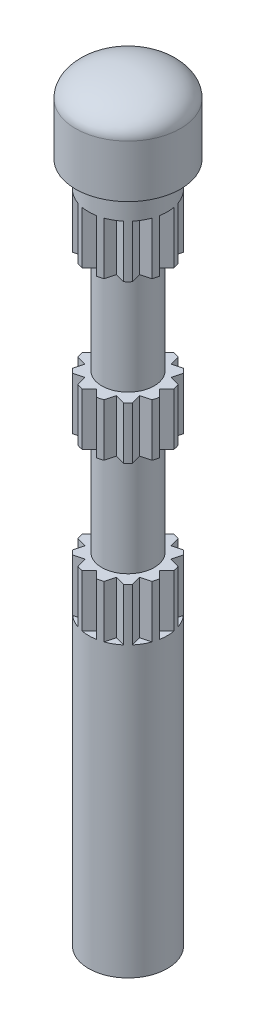
from build123d import *

# Parameters (mm, degrees)
SKETCH_2_R                = 1.288183927
SKETCH_2_R_2              = 0.75
CUT_EXTRUDE_1_DEPTH       = 13
SKETCH_3_R                = 0.4
CUT_EXTRUDE_2_DEPTH       = 5
SKETCH_8_W                = 0.443463538
SKETCH_8_H                = 2
CUT_EXTRUDE_3_DEPTH       = 7
PATTERN_CIRCULAR_13_COUNT = 12


with BuildPart() as part:
    # 草图1 → 旋转1 (revolve)
    with BuildSketch(Plane.XY):
        with BuildLine():
            Line((1, 0), (2, 0))
            Line((2, 0), (2, 14))
            add(Edge.make_bspline(
                [(2, 14), (2, 14.5), (1, 14.5)],
                knots=[0, 0, 0, 1.570796327, 1.570796327, 1.570796327], degree=2, weights=[1, 0.707106781, 1]))
            Line((1, 14.5), (1, 0))
        make_face()
    revolve(axis=Axis((1, 20.110661338, 0), (0, -1, 0)))

    # 草图2 → 切除-拉伸1 (cut)
    with BuildSketch(Plane.XZ):
        with Locations((1, 0)):
            Circle(SKETCH_2_R)
        with Locations((1, 0)):
            Circle(SKETCH_2_R_2, mode=Mode.SUBTRACT)
    extrude(amount=-CUT_EXTRUDE_1_DEPTH, mode=Mode.SUBTRACT)

    # 草图3 → 切除-拉伸2 (cut)
    with BuildSketch(Plane(origin=(0, 0, 0), x_dir=(-1, 0, 0), z_dir=(0, -1, 0))):
        with Locations((-1, 0)):
            Circle(SKETCH_3_R)
    extrude(amount=-CUT_EXTRUDE_2_DEPTH, mode=Mode.SUBTRACT)

    # 草图8 → 切除-旋转1 (revolve, cut)
    with BuildSketch(Plane.XY):
        with Locations((1.721731769, 10.5)):
            Rectangle(SKETCH_8_W, SKETCH_8_H)
        with Locations((1.721731769, 7.5)):
            Rectangle(SKETCH_8_W, SKETCH_8_H)
    revolve(axis=Axis((1, 0, 0), (0, 1, 0)), mode=Mode.SUBTRACT)

    # 草图9 → 切除-拉伸3 (cut)
    with BuildSketch(Plane(origin=(0, 5.5, 0), x_dir=(-1, 0, 0), z_dir=(0, -1, 0))):
        with BuildLine():
            Line((-1.137321392, 0.737321392), (-1, 0.6))
            Line((-1, 0.6), (-0.862678608, 0.737321392))
            ThreePointArc((-0.862678608, 0.737321392), (-1, 0.75), (-1.137321392, 0.737321392))
        make_face()
    cut_extrude_3 = extrude(amount=-CUT_EXTRUDE_3_DEPTH, mode=Mode.SUBTRACT)

    # 阵列(圆周)13: 切除-拉伸3 ×12 about axis
    pattern_circular_13_axis = Axis((1, 13, 0), (0, -1, 0))
    for i in range(1, PATTERN_CIRCULAR_13_COUNT):
        add(cut_extrude_3.rotate(pattern_circular_13_axis, i * 360 / PATTERN_CIRCULAR_13_COUNT), mode=Mode.SUBTRACT)


solid = part.part
